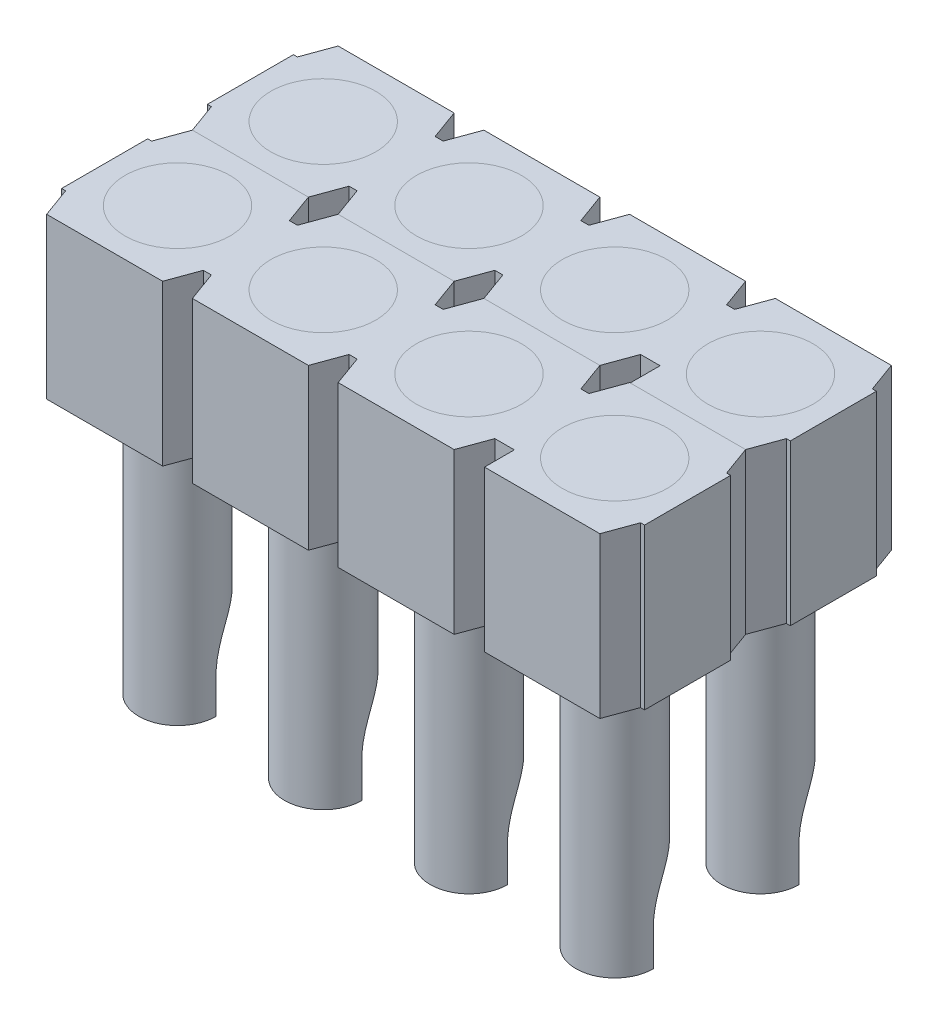
from build123d import *

# Parameters (mm, degrees)
SKETCH1_R              = 0.675
BOSS_EXTRUDE1_DEPTH    = 2.79
CHAMFER3_SIZE          = 0.2
CHAMFER3_SIZE_2        = 0.549495484
SKETCH2_R              = 0.915
CUT_EXTRUDE1_DEPTH     = 0.5
SKETCH3_R              = 0.915
BOSS_EXTRUDE2_DEPTH    = 0.5
SKETCH4_R              = 0.675
BOSS_EXTRUDE3_DEPTH    = 6.87
SKETCH5_R              = 0.485
CUT_EXTRUDE2_DEPTH     = 2.29
CUT_EXTRUDE3_DEPTH     = 5.919573152
LPATTERN1_START        = -2.29
LPATTERN1_OUTLINE_R    = 0.675
LPATTERN1_DEPTH        = 4.58
LPATTERN1_START_2      = -4.58
LPATTERN1_2_DEPTH      = 2.29
LPATTERN1_START_3      = -2.814094852
LPATTERN1_3_DEPTH      = 0.524094852
LPATTERN1_START_4      = -3.863768611
LPATTERN1_4_DEPTH      = 1.049673759
LPATTERN1_START_5      = 6
LPATTERN1_5_DEPTH      = 3
LPATTERN1_6_OUTLINE_R  = 0.675
LPATTERN1_6_DEPTH      = 4.58
LPATTERN1_7_DEPTH      = 2.29
LPATTERN1_8_DEPTH      = 0.524094852
LPATTERN1_9_DEPTH      = 1.049673759
LPATTERN1_START_6      = 3
LPATTERN1_10_DEPTH     = 4
LPATTERN1_11_OUTLINE_R = 0.675
LPATTERN1_11_DEPTH     = 4.58
LPATTERN1_12_DEPTH     = 2.29
LPATTERN1_13_DEPTH     = 0.524094852
LPATTERN1_14_DEPTH     = 1.049673759
LPATTERN1_START_7      = 1
LPATTERN1_15_DEPTH     = 3
LPATTERN1_START_8      = 2.29
LPATTERN1_16_OUTLINE_R = 0.915
LPATTERN1_16_DEPTH     = 0.5
LPATTERN1_17_OUTLINE_R = 0.915
LPATTERN1_17_DEPTH     = 0.5
LPATTERN1_18_OUTLINE_R = 0.915
LPATTERN1_18_DEPTH     = 0.5
LPATTERN1_19_OUTLINE_R = 0.675
LPATTERN1_19_DEPTH     = 2.29
LPATTERN1_20_OUTLINE_R = 0.915
LPATTERN1_20_DEPTH     = 0.5
LPATTERN6_COUNT        = 2
LPATTERN6_PITCH        = 2.54


with BuildPart() as part:
    # Sketch1 → Boss-Extrude1 (new body)
    with BuildSketch(Plane(origin=(0, 0, 0), x_dir=(1, 0, 0), z_dir=(0, 1, 0))):
        Polygon((1, 1.27), (-1, 1.27), (-1, 0.75), (-1.27, 0.75), (-1.27, -0.75), (-1, -0.75), (-1, -1.27), (1, -1.27), (1, -0.75), (1.27, -0.75), (1.27, 0.75), (1, 0.75), align=None)
        with Locations(Location((0, 0, 0), (0, 0, 270))):
            Circle(SKETCH1_R, mode=Mode.SUBTRACT)
    extrude(amount=BOSS_EXTRUDE1_DEPTH)

    # Chamfer3
    # the kernel refuses this chamfer: 0.549495484, 0.2 mm, written as the material it adds along each edge
    with BuildSketch(Plane(origin=(1, 0, -0.75), x_dir=(1, 0, 0), z_dir=(0, 1, 0))) as chamfer3_piece_1_section:
        Polygon((CHAMFER3_SIZE, 0), (0, CHAMFER3_SIZE_2), (0, 0), align=None)
    chamfer3_piece_1 = extrude(amount=2.79, mode=Mode.PRIVATE)
    chamfer3_piece_1 = split(chamfer3_piece_1, bisect_by=Plane(origin=(1, 0, -1.27), z_dir=(0, 0, 1)), keep=Keep.TOP, mode=Mode.PRIVATE)
    add(chamfer3_piece_1)
    with BuildSketch(Plane(origin=(-1, 0, -0.75), x_dir=(0, 0, -1), z_dir=(0, 1, 0))) as chamfer3_piece_2_section:
        Polygon((CHAMFER3_SIZE_2, 0), (0, CHAMFER3_SIZE), (0, 0), align=None)
    chamfer3_piece_2 = extrude(amount=2.79, mode=Mode.PRIVATE)
    chamfer3_piece_2 = split(chamfer3_piece_2, bisect_by=Plane(origin=(-1, 0, -1.27), z_dir=(0, 0, 1)), keep=Keep.TOP, mode=Mode.PRIVATE)
    add(chamfer3_piece_2)
    with BuildSketch(Plane(origin=(-1, 0, 0.75), x_dir=(-1, 0, 0), z_dir=(0, 1, 0))) as chamfer3_piece_3_section:
        Polygon((CHAMFER3_SIZE, 0), (0, CHAMFER3_SIZE_2), (0, 0), align=None)
    chamfer3_piece_3 = extrude(amount=2.79, mode=Mode.PRIVATE)
    chamfer3_piece_3 = split(chamfer3_piece_3, bisect_by=Plane(origin=(-1, 0, 1.27), z_dir=(0, 0, -1)), keep=Keep.TOP, mode=Mode.PRIVATE)
    add(chamfer3_piece_3)
    with BuildSketch(Plane(origin=(1, 0, 0.75), x_dir=(0, 0, 1), z_dir=(0, 1, 0))) as chamfer3_piece_4_section:
        Polygon((CHAMFER3_SIZE_2, 0), (0, CHAMFER3_SIZE), (0, 0), align=None)
    chamfer3_piece_4 = extrude(amount=2.79, mode=Mode.PRIVATE)
    chamfer3_piece_4 = split(chamfer3_piece_4, bisect_by=Plane(origin=(1, 0, 1.27), z_dir=(0, 0, -1)), keep=Keep.TOP, mode=Mode.PRIVATE)
    add(chamfer3_piece_4)

    # Sketch2 → Cut-Extrude1 (cut)
    with BuildSketch(Plane(origin=(0, 2.79, 0), x_dir=(1, 0, 0), z_dir=(0, 1, 0))):
        with Locations(Location((0, 0, 0), (0, 0, 270))):
            Circle(SKETCH2_R)
    extrude(amount=-CUT_EXTRUDE1_DEPTH, mode=Mode.SUBTRACT)

    # LPattern1 19 outline → LPattern1 19 (add)
    with BuildSketch(Plane(origin=(0, 0, 0), x_dir=(1, 0, 0), z_dir=(0, 1, 0))):
        Polygon((1.529264522, 1.27), (1.34, 0.75), (1.27, 0.75), (1.27, -0.75), (1.34, -0.75), (1.529264522, -1.27), (3.550735478, -1.27), (3.74, -0.75), (3.88, -0.75), (4.069264522, -1.27), (6.090735478, -1.27), (6.28, -0.75), (6.62, -0.75), (6.62, -1.27), (8.630735478, -1.27), (8.82, -0.75), (8.89, -0.75), (8.89, 0.75), (8.82, 0.75), (8.630735478, 1.27), (6.609264522, 1.27), (6.42, 0.75), (6.28, 0.75), (6.090735478, 1.27), (4.069264522, 1.27), (3.88, 0.75), (3.74, 0.75), (3.550735478, 1.27), align=None)
        with Locations((2.54, 0)):
            Circle(LPATTERN1_19_OUTLINE_R, mode=Mode.SUBTRACT)
        with Locations((5.08, 0)):
            Circle(LPATTERN1_19_OUTLINE_R, mode=Mode.SUBTRACT)
        with Locations((7.62, 0)):
            Circle(LPATTERN1_19_OUTLINE_R, mode=Mode.SUBTRACT)
    extrude(amount=LPATTERN1_19_DEPTH)

    # LPattern1 20 outline → LPattern1 20 (add)
    with BuildSketch(Plane(origin=(0, 0, 0), x_dir=(1, 0, 0), z_dir=(0, 1, 0)).offset(LPATTERN1_START_8)):
        Polygon((1.529264522, 1.27), (1.34, 0.75), (1.27, 0.75), (1.27, -0.75), (1.34, -0.75), (1.529264522, -1.27), (3.550735478, -1.27), (3.74, -0.75), (3.88, -0.75), (4.069264522, -1.27), (6.090735478, -1.27), (6.28, -0.75), (6.62, -0.75), (6.62, -1.27), (8.630735478, -1.27), (8.82, -0.75), (8.89, -0.75), (8.89, 0.75), (8.82, 0.75), (8.630735478, 1.27), (6.609264522, 1.27), (6.42, 0.75), (6.28, 0.75), (6.090735478, 1.27), (4.069264522, 1.27), (3.88, 0.75), (3.74, 0.75), (3.550735478, 1.27), align=None)
        with Locations((2.54, 0)):
            Circle(LPATTERN1_20_OUTLINE_R, mode=Mode.SUBTRACT)
        with Locations((5.08, 0)):
            Circle(LPATTERN1_20_OUTLINE_R, mode=Mode.SUBTRACT)
        with Locations((7.62, 0)):
            Circle(LPATTERN1_20_OUTLINE_R, mode=Mode.SUBTRACT)
    extrude(amount=LPATTERN1_20_DEPTH)


with BuildPart() as body_2:
    # Sketch3 → Boss-Extrude2 (new body)
    with BuildSketch(Plane(origin=(0, 2.79, 0), x_dir=(1, 0, 0), z_dir=(0, 1, 0))):
        with Locations(Location((0, 0, 0), (0, 0, 270))):
            Circle(SKETCH3_R)
    extrude(amount=-BOSS_EXTRUDE2_DEPTH)


with BuildPart() as body_3:
    # Sketch4 → Boss-Extrude3 (new body)
    with BuildSketch(Plane.XZ.offset(-2.29)):
        with Locations(Location((0, 0, 0), (0, 0, 90))):
            Circle(SKETCH4_R)
    extrude(amount=BOSS_EXTRUDE3_DEPTH)

    # Sketch5 → Cut-Extrude2 (cut)
    with BuildSketch(Plane.XZ.offset(4.58)):
        with Locations(Location((0, 0, 0), (0, 0, 270))):
            Circle(SKETCH5_R)
    extrude(amount=-CUT_EXTRUDE2_DEPTH, mode=Mode.SUBTRACT)

    # Sketch6 → Cut-Extrude3 (cut, symmetric)
    with BuildSketch(Plane(origin=(0, 0, 0), x_dir=(0, 0, -1), z_dir=(1, 0, 0))):
        with BuildLine():
            Line((0.675, -4.58), (0, -4.58))
            Line((0, -4.58), (0, -3.863768511))
            ThreePointArc((0, -3.863768511), (0.203322314, -3.25264809), (0.675, -2.814095593))
            Line((0.675, -2.814095593), (0.675, -4.58))
        make_face()
    extrude(amount=CUT_EXTRUDE3_DEPTH, both=True, mode=Mode.SUBTRACT)


with BuildPart() as body_4:
    # LPattern1: read off the stored shape, not the designer's step
    # LPattern1 outline → LPattern1 (new body)
    with BuildSketch(Plane(origin=(0, 0, 0), x_dir=(1, 0, 0), z_dir=(0, 1, 0)).offset(LPATTERN1_START)):
        with Locations((7.62, 0)):
            Circle(LPATTERN1_OUTLINE_R)
    extrude(amount=LPATTERN1_DEPTH)

    # LPattern1 2 outline → LPattern1 2 (add)
    with BuildSketch(Plane(origin=(0, 0, 0), x_dir=(1, 0, 0), z_dir=(0, 1, 0)).offset(LPATTERN1_START_2)):
        with BuildLine():
            ThreePointArc((6.945, 0), (7.62, -0.675), (8.295, 0))
            Line((8.295, 0), (8.105, 0))
            ThreePointArc((8.105, 0), (7.62, -0.485), (7.135, 0))
            Line((7.135, 0), (6.945, 0))
        make_face()
    extrude(amount=LPATTERN1_2_DEPTH)

    # LPattern1 3 outline → LPattern1 3 (add)
    with BuildSketch(Plane(origin=(0, 0, 0), x_dir=(1, 0, 0), z_dir=(0, 1, 0)).offset(LPATTERN1_START_3)):
        with BuildLine():
            Line((8.105, 0), (8.295, 0))
            ThreePointArc((8.295, 0), (7.62, 0.675), (6.945, 0))
            Line((6.945, 0), (7.135, 0))
            ThreePointArc((7.135, 0), (7.62, 0.485), (8.105, 0))
        make_face()
    extrude(amount=LPATTERN1_3_DEPTH)

    # LPattern1 4 outline → LPattern1 4 (add)
    with BuildSketch(Plane(origin=(0, 0, 0), x_dir=(1, 0, 0), z_dir=(0, 1, 0)).offset(LPATTERN1_START_4)):
        with BuildLine():
            ThreePointArc((7.135, 0), (7.62, 0.485), (8.105, 0))
            Line((8.105, 0), (8.295, 0))
            ThreePointArc((8.295, 0), (7.62, 0.675), (6.945, 0))
            Line((6.945, 0), (7.135, 0))
        make_face()
    extrude(amount=LPATTERN1_4_DEPTH)

    # LPattern1 5 outline → LPattern1 5 (cut)
    with BuildSketch(Plane.YZ.offset(LPATTERN1_START_5)):
        with BuildLine():
            Line((-2.092665327, -2), (-2.814011576, -0.675154284))
            ThreePointArc((-2.814011576, -0.675154284), (-3.25257421, -0.203369826), (-3.863768511, 0))
            Line((-3.863768511, 0), (-3.863768611, -2))
            Line((-3.863768611, -2), (-2.092665327, -2))
        make_face()
    extrude(amount=LPATTERN1_5_DEPTH, mode=Mode.SUBTRACT)


with BuildPart() as body_5:
    # LPattern1 6 outline → LPattern1 6 (new body)
    with BuildSketch(Plane(origin=(0, 0, 0), x_dir=(1, 0, 0), z_dir=(0, 1, 0)).offset(LPATTERN1_START)):
        with Locations((5.08, 0)):
            Circle(LPATTERN1_6_OUTLINE_R)
    extrude(amount=LPATTERN1_6_DEPTH)

    # LPattern1 7 outline → LPattern1 7 (add)
    with BuildSketch(Plane(origin=(0, 0, 0), x_dir=(1, 0, 0), z_dir=(0, 1, 0)).offset(LPATTERN1_START_2)):
        with BuildLine():
            ThreePointArc((4.405, 0), (5.08, -0.675), (5.755, 0))
            Line((5.755, 0), (5.565, 0))
            ThreePointArc((5.565, 0), (5.08, -0.485), (4.595, 0))
            Line((4.595, 0), (4.405, 0))
        make_face()
    extrude(amount=LPATTERN1_7_DEPTH)

    # LPattern1 8 outline → LPattern1 8 (add)
    with BuildSketch(Plane(origin=(0, 0, 0), x_dir=(1, 0, 0), z_dir=(0, 1, 0)).offset(LPATTERN1_START_3)):
        with BuildLine():
            Line((5.565, 0), (5.755, 0))
            ThreePointArc((5.755, 0), (5.08, 0.675), (4.405, 0))
            Line((4.405, 0), (4.595, 0))
            ThreePointArc((4.595, 0), (5.08, 0.485), (5.565, 0))
        make_face()
    extrude(amount=LPATTERN1_8_DEPTH)

    # LPattern1 9 outline → LPattern1 9 (add)
    with BuildSketch(Plane(origin=(0, 0, 0), x_dir=(1, 0, 0), z_dir=(0, 1, 0)).offset(LPATTERN1_START_4)):
        with BuildLine():
            ThreePointArc((4.595, 0), (5.08, 0.485), (5.565, 0))
            Line((5.565, 0), (5.755, 0))
            ThreePointArc((5.755, 0), (5.08, 0.675), (4.405, 0))
            Line((4.405, 0), (4.595, 0))
        make_face()
    extrude(amount=LPATTERN1_9_DEPTH)

    # LPattern1 10 outline → LPattern1 10 (cut)
    with BuildSketch(Plane.YZ.offset(LPATTERN1_START_6)):
        with BuildLine():
            Line((-2.092665327, -2), (-2.814011576, -0.675154284))
            ThreePointArc((-2.814011576, -0.675154284), (-3.25257421, -0.203369826), (-3.863768511, 0))
            Line((-3.863768511, 0), (-3.863768611, -2))
            Line((-3.863768611, -2), (-2.092665327, -2))
        make_face()
    extrude(amount=LPATTERN1_10_DEPTH, mode=Mode.SUBTRACT)


with BuildPart() as body_6:
    # LPattern1 11 outline → LPattern1 11 (new body)
    with BuildSketch(Plane(origin=(0, 0, 0), x_dir=(1, 0, 0), z_dir=(0, 1, 0)).offset(LPATTERN1_START)):
        with Locations((2.54, 0)):
            Circle(LPATTERN1_11_OUTLINE_R)
    extrude(amount=LPATTERN1_11_DEPTH)

    # LPattern1 12 outline → LPattern1 12 (add)
    with BuildSketch(Plane(origin=(0, 0, 0), x_dir=(1, 0, 0), z_dir=(0, 1, 0)).offset(LPATTERN1_START_2)):
        with BuildLine():
            ThreePointArc((1.865, 0), (2.54, -0.675), (3.215, 0))
            Line((3.215, 0), (3.025, 0))
            ThreePointArc((3.025, 0), (2.54, -0.485), (2.055, 0))
            Line((2.055, 0), (1.865, 0))
        make_face()
    extrude(amount=LPATTERN1_12_DEPTH)

    # LPattern1 13 outline → LPattern1 13 (add)
    with BuildSketch(Plane(origin=(0, 0, 0), x_dir=(1, 0, 0), z_dir=(0, 1, 0)).offset(LPATTERN1_START_3)):
        with BuildLine():
            Line((3.025, 0), (3.215, 0))
            ThreePointArc((3.215, 0), (2.54, 0.675), (1.865, 0))
            Line((1.865, 0), (2.055, 0))
            ThreePointArc((2.055, 0), (2.54, 0.485), (3.025, 0))
        make_face()
    extrude(amount=LPATTERN1_13_DEPTH)

    # LPattern1 14 outline → LPattern1 14 (add)
    with BuildSketch(Plane(origin=(0, 0, 0), x_dir=(1, 0, 0), z_dir=(0, 1, 0)).offset(LPATTERN1_START_4)):
        with BuildLine():
            ThreePointArc((2.055, 0), (2.54, 0.485), (3.025, 0))
            Line((3.025, 0), (3.215, 0))
            ThreePointArc((3.215, 0), (2.54, 0.675), (1.865, 0))
            Line((1.865, 0), (2.055, 0))
        make_face()
    extrude(amount=LPATTERN1_14_DEPTH)

    # LPattern1 15 outline → LPattern1 15 (cut)
    with BuildSketch(Plane.YZ.offset(LPATTERN1_START_7)):
        with BuildLine():
            Line((-2.092665327, -2), (-2.814011576, -0.675154284))
            ThreePointArc((-2.814011576, -0.675154284), (-3.25257421, -0.203369826), (-3.863768511, 0))
            Line((-3.863768511, 0), (-3.863768611, -2))
            Line((-3.863768611, -2), (-2.092665327, -2))
        make_face()
    extrude(amount=LPATTERN1_15_DEPTH, mode=Mode.SUBTRACT)


with BuildPart() as body_7:
    # LPattern1 16 outline → LPattern1 16 (new body)
    with BuildSketch(Plane(origin=(0, 0, 0), x_dir=(1, 0, 0), z_dir=(0, 1, 0)).offset(LPATTERN1_START_8)):
        with Locations((7.62, 0)):
            Circle(LPATTERN1_16_OUTLINE_R)
    extrude(amount=LPATTERN1_16_DEPTH)


with BuildPart() as body_8:
    # LPattern1 17 outline → LPattern1 17 (new body)
    with BuildSketch(Plane(origin=(0, 0, 0), x_dir=(1, 0, 0), z_dir=(0, 1, 0)).offset(LPATTERN1_START_8)):
        with Locations((5.08, 0)):
            Circle(LPATTERN1_17_OUTLINE_R)
    extrude(amount=LPATTERN1_17_DEPTH)


with BuildPart() as body_9:
    # LPattern1 18 outline → LPattern1 18 (new body)
    with BuildSketch(Plane(origin=(0, 0, 0), x_dir=(1, 0, 0), z_dir=(0, 1, 0)).offset(LPATTERN1_START_8)):
        with Locations((2.54, 0)):
            Circle(LPATTERN1_18_OUTLINE_R)
    extrude(amount=LPATTERN1_18_DEPTH)


with BuildPart() as lpattern6_1:
    # LPattern6: pattern copy
    add(body_5.part.moved(Location(Vector(0, 0, -1) * (1 * LPATTERN6_PITCH))))


with BuildPart() as lpattern6_2:
    # LPattern6: pattern copy
    add(body_8.part.moved(Location(Vector(0, 0, -1) * (1 * LPATTERN6_PITCH))))


with BuildPart() as lpattern6_3:
    # LPattern6: pattern copy
    add(body_9.part.moved(Location(Vector(0, 0, -1) * (1 * LPATTERN6_PITCH))))


with BuildPart() as lpattern6_4:
    # LPattern6: pattern copy
    add(part.part.moved(Location(Vector(0, 0, -1) * (1 * LPATTERN6_PITCH))))


with BuildPart() as lpattern6_5:
    # LPattern6: pattern copy
    add(body_6.part.moved(Location(Vector(0, 0, -1) * (1 * LPATTERN6_PITCH))))


with BuildPart() as lpattern6_6:
    # LPattern6: pattern copy
    add(body_3.part.moved(Location(Vector(0, 0, -1) * (1 * LPATTERN6_PITCH))))


with BuildPart() as lpattern6_7:
    # LPattern6: pattern copy
    add(body_4.part.moved(Location(Vector(0, 0, -1) * (1 * LPATTERN6_PITCH))))


with BuildPart() as lpattern6_8:
    # LPattern6: pattern copy
    add(body_2.part.moved(Location(Vector(0, 0, -1) * (1 * LPATTERN6_PITCH))))


with BuildPart() as lpattern6_9:
    # LPattern6: pattern copy
    add(body_7.part.moved(Location(Vector(0, 0, -1) * (1 * LPATTERN6_PITCH))))


solid = Compound([part.part, body_2.part, body_3.part, body_4.part, body_5.part, body_6.part, body_7.part, body_8.part, body_9.part, lpattern6_1.part, lpattern6_2.part, lpattern6_3.part, lpattern6_4.part, lpattern6_5.part, lpattern6_6.part, lpattern6_7.part, lpattern6_8.part, lpattern6_9.part])
